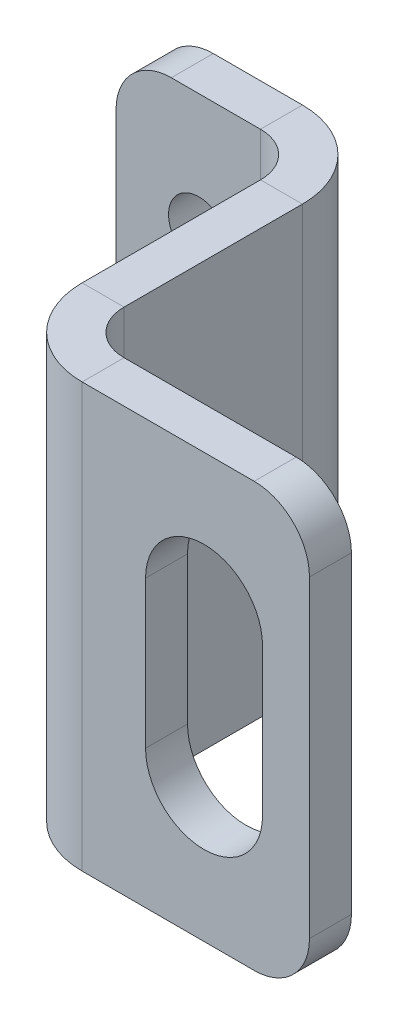
from build123d import *

# Parameters (mm, degrees)
SKETCH1_W                    = 25
SKETCH1_H                    = 46
BASE_FLANGE1_DEPTH           = 4.55422
EDGE_FLANGE2_STRIP_W         = 27.74188
EDGE_FLANGE2_STRIP_H         = 4.55422
EDGE_FLANGE2_STRIP_CUT_DEPTH = 46
EDGE_FLANGE2_DEPTH           = 46
EDGE_FLANGE3_STRIP_W         = 27.74188
EDGE_FLANGE3_STRIP_H         = 4.55422
EDGE_FLANGE3_STRIP_CUT_DEPTH = 46
EDGE_FLANGE3_DEPTH           = 46
FILLET1_R                    = 6
M6_CLEARANCE_HOLE1_D         = 6.6
CUT_EXTRUDE1_DEPTH           = 76.830940915


# Sheet-metal steps are written as plain solids
with BuildPart() as part:
    # Sketch1 → Base-Flange1 (new body)
    with BuildSketch(Plane.XY):
        with Locations((-12.5, 0)):
            Rectangle(SKETCH1_W, SKETCH1_H)
    extrude(amount=-BASE_FLANGE1_DEPTH)

    # Edge-Flange2 strip (across the edge) → Edge-Flange2 strip cut (cut)
    with BuildSketch(Plane(origin=(0, -23, 0), x_dir=(-1, 0, 0), z_dir=(0, 1, 0))):
        with Locations((-4.55422, -2.27711)):
            Rectangle(EDGE_FLANGE2_STRIP_W, EDGE_FLANGE2_STRIP_H)
    extrude(amount=EDGE_FLANGE2_STRIP_CUT_DEPTH, mode=Mode.SUBTRACT)

    # Edge-Flange2 section (across the edge) → Edge-Flange2 (add)
    with BuildSketch(Plane(origin=(0, -23, 0), x_dir=(-1, 0, 0), z_dir=(0, 1, 0))):
        with BuildLine():
            Line((0, 4.7625), (0, 33.44578))
            Line((0, 33.44578), (4.55422, 33.44578))
            Line((4.55422, 33.44578), (4.55422, 4.7625))
            ThreePointArc((4.55422, 4.7625), (5.949123955, 1.394903955), (9.31672, 0))
            Line((9.31672, 0), (9.31672, -4.55422))
            ThreePointArc((9.31672, -4.55422), (2.72880411, -1.82541589), (0, 4.7625))
        make_face()
    extrude(amount=EDGE_FLANGE2_DEPTH)

    # Edge-Flange3 strip (across the edge) → Edge-Flange3 strip cut (cut)
    with BuildSketch(Plane(origin=(0, 23, 33.44578), x_dir=(0, 0, -1), z_dir=(0, -1, 0))):
        with Locations((-4.55422, -2.27711)):
            Rectangle(EDGE_FLANGE3_STRIP_W, EDGE_FLANGE3_STRIP_H)
    extrude(amount=EDGE_FLANGE3_STRIP_CUT_DEPTH, mode=Mode.SUBTRACT)

    # Edge-Flange3 section (across the edge) → Edge-Flange3 (add)
    with BuildSketch(Plane(origin=(0, 23, 33.44578), x_dir=(0, 0, -1), z_dir=(0, -1, 0))):
        with BuildLine():
            Line((0, 4.7625), (0, 29.44578))
            Line((0, 29.44578), (4.55422, 29.44578))
            Line((4.55422, 29.44578), (4.55422, 4.7625))
            ThreePointArc((4.55422, 4.7625), (5.949123955, 1.394903955), (9.31672, 0))
            Line((9.31672, 0), (9.31672, -4.55422))
            ThreePointArc((9.31672, -4.55422), (2.72880411, -1.82541589), (0, 4.7625))
        make_face()
    extrude(amount=EDGE_FLANGE3_DEPTH)

    # Fillet1
    fillet1_edges = [part.edges().sort_by_distance(p)[0] for p in [
        (29.44578, 23, 31.16867),
        (29.44578, -23, 31.16867),
        (-25, 23, -2.27711),
        (-25, -23, -2.27711),
    ]]
    fillet(fillet1_edges, radius=FILLET1_R)

    # M6 Clearance Hole1 (through all)
    with Locations(Plane.XY):
        with Locations((-16, 10), (-16, -10)):
            Hole(M6_CLEARANCE_HOLE1_D / 2)

    # Sketch12 → Cut-Extrude1 (cut, through all)
    with BuildSketch(Plane(origin=(-32.01422, 0, 33.44578), x_dir=(1, 0, 0), z_dir=(0, 0, 1))):
        with BuildLine():
            Line((43.66422, -8), (43.66422, 8))
            ThreePointArc((43.66422, 8), (50.01422, 14.35), (56.36422, 8))
            Line((56.36422, 8), (56.36422, -8))
            ThreePointArc((56.36422, -8), (50.01422, -14.35), (43.66422, -8))
        make_face()
    extrude(amount=-CUT_EXTRUDE1_DEPTH, mode=Mode.SUBTRACT)


solid = part.part
